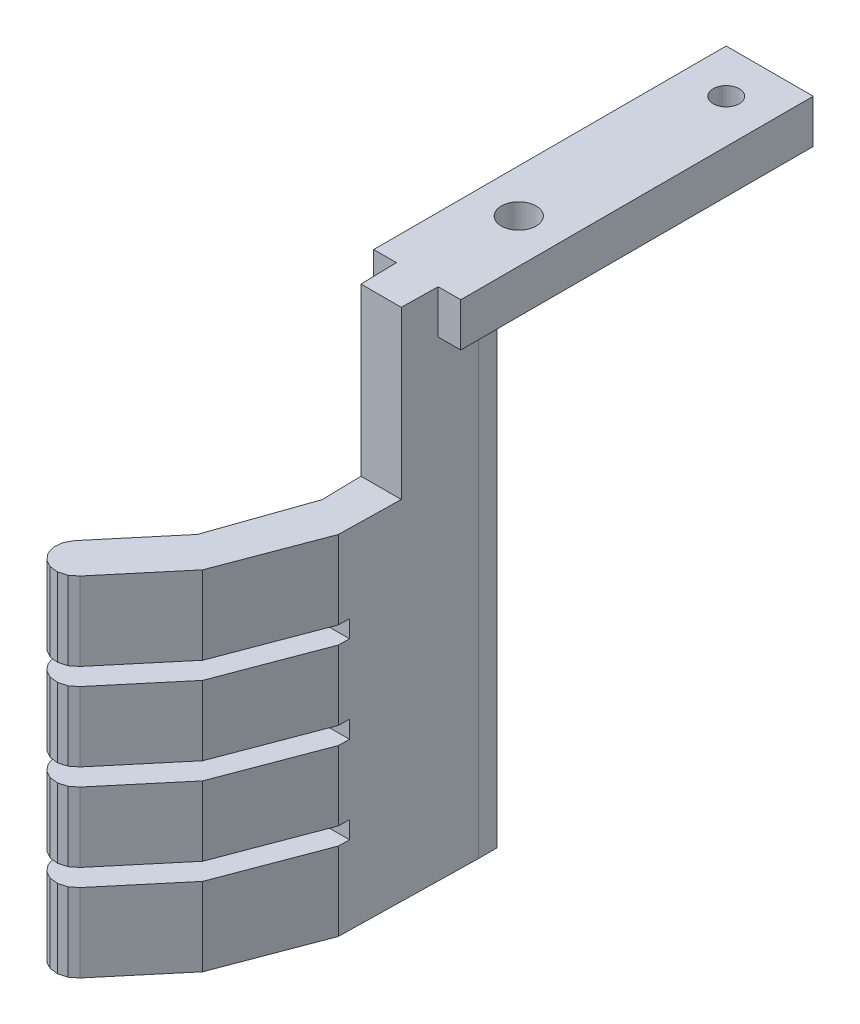
from build123d import *

# Parameters (mm, degrees)
BOSS_EXTRUDE1_START     = 7.2
SKETCH1_W               = 6
SKETCH1_H               = 3
BOSS_EXTRUDE1_DEPTH     = 24.3
BOSS_EXTRUDE2_START     = -12
BOSS_EXTRUDE2_DEPTH     = 35.475
CUT_EXTRUDE1_DEPTH      = 60.165739166
CUT_EXTRUDE1_DEPTH_BACK = 60.165739166
SKETCH3_R               = 1.2
SKETCH3_R_2             = 0.9
CUT_EXTRUDE2_DEPTH      = 60.165739166
CUT_EXTRUDE2_DEPTH_BACK = 60.165739166
SKETCH4_W               = 42.5
SKETCH4_H               = 1.2
SKETCH4_W_2             = 46
SKETCH4_H_2             = 12.475


with BuildPart() as part:
    # Sketch1 → Boss-Extrude1 (new body)
    with BuildSketch(Plane.XY.offset(BOSS_EXTRUDE1_START)):
        with Locations((17.8, 21.975)):
            Rectangle(SKETCH1_W, SKETCH1_H)
    extrude(amount=BOSS_EXTRUDE1_DEPTH)

    # Sketch2 → Boss-Extrude2 (add)
    with BuildSketch(Plane(origin=(0, 0, 0), x_dir=(1, 0, 0), z_dir=(0, 1, 0)).offset(BOSS_EXTRUDE2_START)):
        Polygon((16.3, -27.5), (16.3, -28.235509529), (16.480922138, -36.738430041), (14.256792332, -43.113666931), (10.400066674, -47.70993359), (10.118557912, -48.223056305), (10.054841291, -48.804848618), (10.218617089, -49.366737924), (10.584951924, -49.823181669), (11.098074639, -50.10469043), (11.679866953, -50.168407051), (12.241756258, -50.004631254), (12.698200003, -49.638296419), (16.554925661, -45.04202976), (19.119077862, -38.261569959), (19.3, -28.764490471), (19.3, -27.5), align=None)
    extrude(amount=BOSS_EXTRUDE2_DEPTH)

    # Sketch3 → Cut-Extrude1 (cut, two sides: drawn at the far end of the back side and taken through both)
    with BuildSketch(Plane(origin=(0, 0, 0), x_dir=(1, 0, 0), z_dir=(0, 1, 0)).offset(-CUT_EXTRUDE1_DEPTH_BACK)):
        with Locations((17.8, -24.5)):
            Circle(SKETCH3_R)
        with Locations((17.8, -10.2)):
            Circle(SKETCH3_R_2)
    extrude(amount=CUT_EXTRUDE1_DEPTH + CUT_EXTRUDE1_DEPTH_BACK, mode=Mode.SUBTRACT)

    # Sketch4 → Cut-Extrude2 (cut, two sides: drawn at the far end of the back side and taken through both)
    with BuildSketch(Plane(origin=(0, 0, 0), x_dir=(0, 0, -1), z_dir=(1, 0, 0)).offset(-CUT_EXTRUDE2_DEPTH_BACK)):
        with Locations((-58.75, -6)):
            Rectangle(SKETCH4_W, SKETCH4_H)
        with Locations((-58.75, 0)):
            Rectangle(SKETCH4_W, SKETCH4_H)
        with Locations((-58.75, 6)):
            Rectangle(SKETCH4_W, SKETCH4_H)
        with Locations((-57, 18.2375)):
            Rectangle(SKETCH4_W_2, SKETCH4_H_2)
    extrude(amount=CUT_EXTRUDE2_DEPTH + CUT_EXTRUDE2_DEPTH_BACK, mode=Mode.SUBTRACT)


solid = part.part
